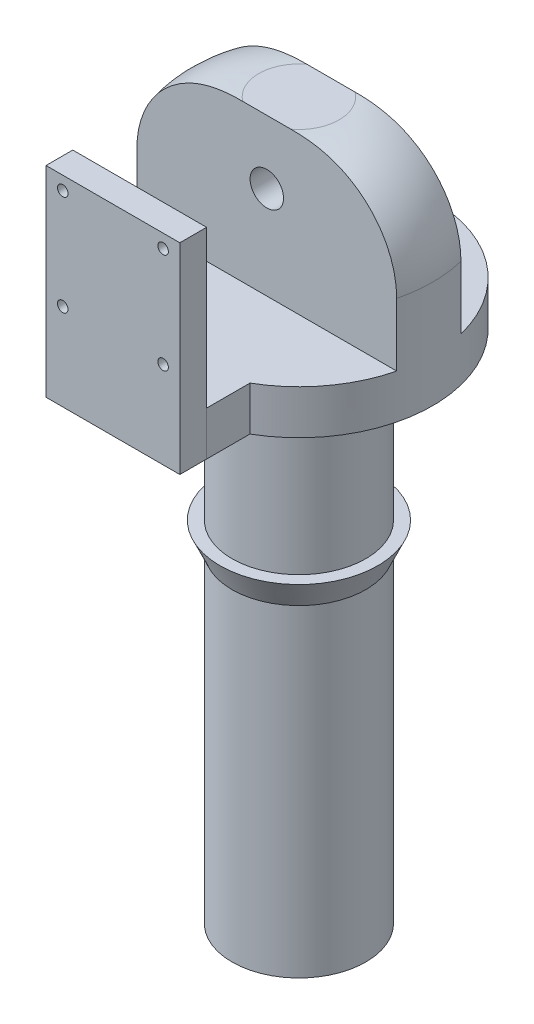
from build123d import *

# Parameters (mm, degrees)
SKETCH1_R                            = 12.7
PART_THAT_GOES_INTO_BASE_DEPTH       = 97.79
SKETCH3_R                            = 25.4
TOP_PART_EXTRUDE_DEPTH               = 38.1
CUT_START                            = -75.457631354
CUT_TO_ACCOMMODATE_ENCODER_OUTLINE_W = 19.304
CUT_TO_ACCOMMODATE_ENCODER_OUTLINE_H = 29.718
CUT_TO_ACCOMMODATE_ENCODER_DEPTH     = 49.315262708
SKETCH7_R                            = 3.175
BOLT_HOLE_DEPTH                      = 12.192
FILLET_TO_ACCOMMODATE_SHOULDER_R     = 17.78
BOSS_EXTRUDE1_DEPTH                  = 38.1
BOSS_EXTRUDE2_START                  = -8.382
BOSS_EXTRUDE2_DEPTH                  = 8.382
SKETCH13_R                           = 1
CUT_EXTRUDE1_DEPTH                   = 5.08


# Read off the part's stored shape, not the designer's step: Cut to Accommodate Encoder
with BuildPart() as part:
    # Sketch1 → Part that goes into base (new body)
    with BuildSketch(Plane(origin=(0, 0, 0), x_dir=(1, 0, 0), z_dir=(0, 1, 0))):
        with Locations(Location((0, 0, 0), (0, 0, 270))):
            Circle(SKETCH1_R)
    extrude(amount=PART_THAT_GOES_INTO_BASE_DEPTH)

    # Sketch2 → Clip in mechanism (revolve)
    with BuildSketch(Plane.XY, mode=Mode.PRIVATE) as clip_in_mechanism_sk:
        Polygon((12.7, 61.214), (12.7, 66.294), (14.986, 66.294), align=None)
    revolve(clip_in_mechanism_sk.sketch.rotate(Axis((0, 97.79, 0), (0, -1, 0)), 90), axis=Axis((0, 97.79, 0), (0, -1, 0)))

    # Sketch3 → Top part Extrude (add)
    with BuildSketch(Plane(origin=(0, 97.79, 0), x_dir=(1, 0, 0), z_dir=(0, 1, 0))):
        with Locations(Location((0, 0, 0), (0, 0, 90))):
            Circle(SKETCH3_R)
    extrude(amount=TOP_PART_EXTRUDE_DEPTH)

    # Cut to Accommodate Encoder outline → Cut to Accommodate Encoder (cut)
    with BuildSketch(Plane(origin=(50.8, 0, 0), x_dir=(0, 0, -1), z_dir=(1, 0, 0)).offset(CUT_START)):
        with Locations((15.748, 121.031)):
            Rectangle(CUT_TO_ACCOMMODATE_ENCODER_OUTLINE_W, CUT_TO_ACCOMMODATE_ENCODER_OUTLINE_H)
        with Locations((-15.748, 121.031)):
            Rectangle(CUT_TO_ACCOMMODATE_ENCODER_OUTLINE_W, CUT_TO_ACCOMMODATE_ENCODER_OUTLINE_H)
    extrude(amount=CUT_TO_ACCOMMODATE_ENCODER_DEPTH, mode=Mode.SUBTRACT)

    # Sketch7 → Bolt Hole (cut)
    with BuildSketch(Plane(origin=(0, 0, -6.096), x_dir=(-1, 0, 0), z_dir=(0, 0, -1))):
        with Locations(Location((0, 123.825, 0), (0, 0, 90))):
            Circle(SKETCH7_R)
    extrude(amount=-BOLT_HOLE_DEPTH, mode=Mode.SUBTRACT)

    # Fillet to Accommodate shoulder
    fillet_to_accommodate_shoulder_edges = [part.edges().sort_by_distance(p)[0] for p in [
        (25.4, 135.89, 0),
        (-25.4, 135.89, 0),
    ]]
    fillet(fillet_to_accommodate_shoulder_edges, radius=FILLET_TO_ACCOMMODATE_SHOULDER_R)

    # Sketch12 → Boss-Extrude2 (add)
    with BuildSketch(Plane(origin=(0, 106.172, 0), x_dir=(1, 0, 0), z_dir=(0, 1, 0)).offset(BOSS_EXTRUDE2_START)):
        with BuildLine():
            Line((12.7, -23.876), (12.7, -21.997045256))
            ThreePointArc((12.7, -21.997045256), (10.724145631, -23.02504507), (8.665830831, -23.876))
            ThreePointArc((8.665830831, -23.876), (0, -25.4), (-8.665830831, -23.876))
            ThreePointArc((-8.665830831, -23.876), (-10.724145631, -23.02504507), (-12.7, -21.997045256))
            Line((-12.7, -21.997045256), (-12.7, -23.876))
            Line((-12.7, -23.876), (-12.7, -30.226))
            Line((-12.7, -30.226), (12.7, -30.226))
            Line((12.7, -30.226), (12.7, -23.876))
        make_face()
    extrude(amount=BOSS_EXTRUDE2_DEPTH)


with BuildPart() as body_2:
    # Sketch11 → Boss-Extrude1 (new body)
    with BuildSketch(Plane(origin=(0, 135.89, 0), x_dir=(1, 0, 0), z_dir=(0, 1, 0))):
        Polygon((12.7, -30.226), (12.7, -35.306), (-12.7, -35.306), (-12.7, -30.226), (-8.665830831, -30.226), (8.665830831, -30.226), align=None)
    extrude(amount=-BOSS_EXTRUDE1_DEPTH)

    # Sketch13 → Cut-Extrude1 (cut)
    with BuildSketch(Plane(origin=(0, 0, 30.226), x_dir=(-1, 0, 0), z_dir=(0, 0, -1))):
        with Locations((-9.525, 114.3)):
            Circle(SKETCH13_R)
        with Locations((-9.525, 133.35)):
            Circle(SKETCH13_R)
        with Locations((9.525, 114.3)):
            Circle(SKETCH13_R)
        with Locations((9.525, 133.35)):
            Circle(SKETCH13_R)
    extrude(amount=-CUT_EXTRUDE1_DEPTH, mode=Mode.SUBTRACT)


solid = Compound([part.part, body_2.part])
